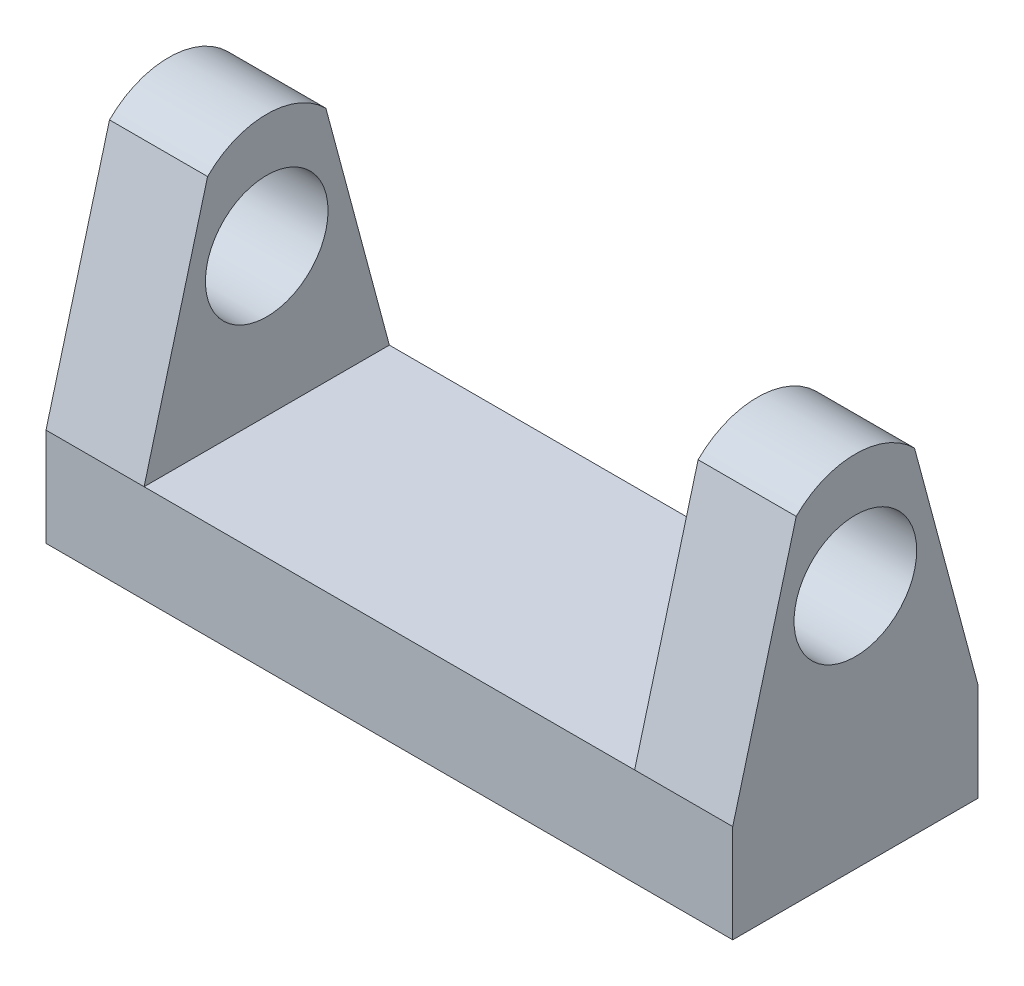
from build123d import *

# Parameters (mm, degrees)
SKETCH1_W           = 35.56
SKETCH1_H           = 12.7
BOSS_EXTRUDE1_DEPTH = 5.08
BOSS_EXTRUDE2_DEPTH = 5.08
SKETCH3_R           = 3.175
CUT_EXTRUDE1_DEPTH  = 41.637314242


with BuildPart() as part:
    # Sketch1 → Boss-Extrude1 (new body)
    with BuildSketch(Plane(origin=(0, 0, 0), x_dir=(1, 0, 0), z_dir=(0, 1, 0))):
        Rectangle(SKETCH1_W, SKETCH1_H)
    extrude(amount=BOSS_EXTRUDE1_DEPTH)

    # Sketch2 → Boss-Extrude2 (add)
    with BuildSketch(Plane(origin=(17.78, 0, 0), x_dir=(0, 0, -1), z_dir=(1, 0, 0))):
        with BuildLine():
            Line((-6.35, 5.08), (-3.062998127, 17.347257994))
            ThreePointArc((-3.062998127, 17.347257994), (0, 18.61599336), (3.062998127, 17.347257994))
            Line((3.062998127, 17.347257994), (6.35, 5.08))
            Line((6.35, 5.08), (-6.35, 5.08))
        make_face()
    boss_extrude2 = extrude(amount=-BOSS_EXTRUDE2_DEPTH)

    # Mirror1: Boss-Extrude2 across plane
    add(boss_extrude2.mirror(Plane(origin=(0, 0, 0), x_dir=(0, 0, 1), z_dir=(1, 0, 0))))

    # Sketch3 → Cut-Extrude1 (cut, through all)
    with BuildSketch(Plane(origin=(17.78, 0, 0), x_dir=(0, 0, -1), z_dir=(1, 0, 0))):
        with Locations((0, 12.7)):
            Circle(SKETCH3_R)
    extrude(amount=-CUT_EXTRUDE1_DEPTH, mode=Mode.SUBTRACT)


solid = part.part
